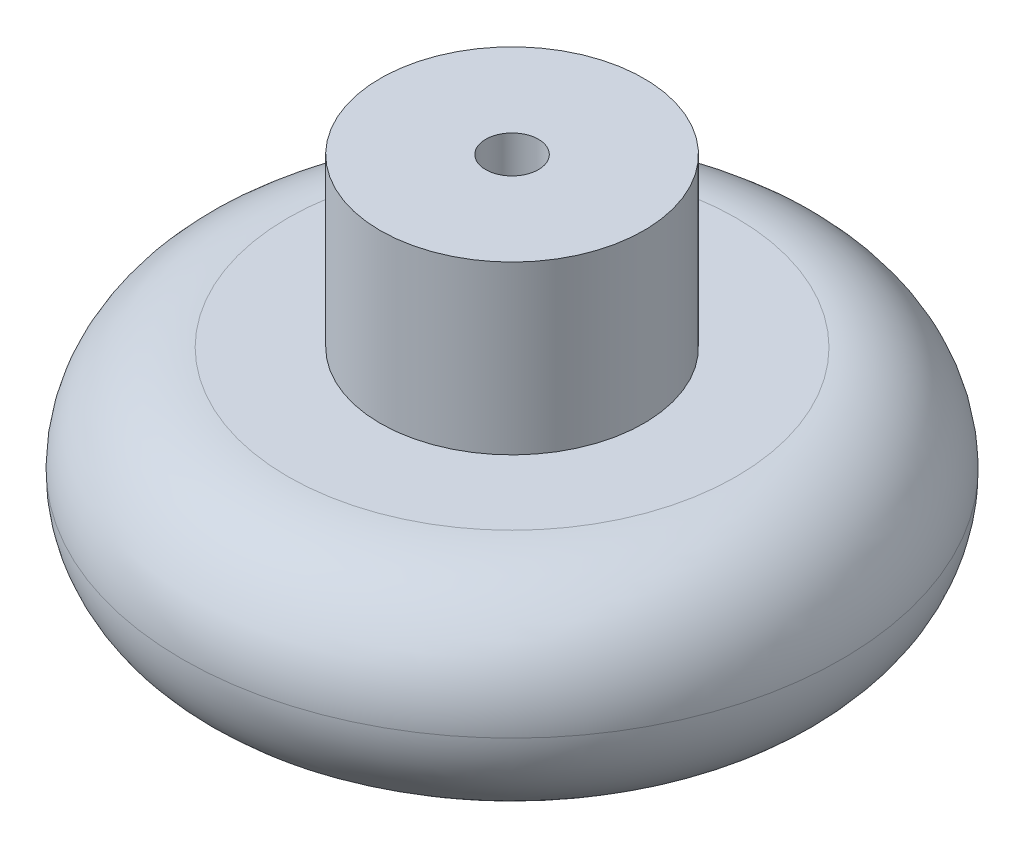
from build123d import *

# Parameters (mm, degrees)
SKETCH_1_R                = 37.5
EXTRUDE_1_DEPTH           = 24
SKETCH_3_R                = 15
EXTRUDE_2_DEPTH           = 19
HOLE_WIZARD_6_0_6_1_D     = 6
HOLE_WIZARD_6_0_6_1_DEPTH = 15
HOLE_WIZARD_6_0_6_1_TIP   = 1.802581857
FILLET_1_R                = 12
HOLE_WIZARD_M6_2_D        = 5
HOLE_WIZARD_M6_2_DEPTH    = 15
HOLE_WIZARD_M6_2_TIP      = 1.502151548


with BuildPart() as part:
    # 草图1 → 凸台-拉伸1 (new body)
    with BuildSketch(Plane(origin=(0, 0, 0), x_dir=(1, 0, 0), z_dir=(0, 1, 0))):
        with Locations(Location((0, 0, 0), (0, 0, 270))):
            Circle(SKETCH_1_R)
    extrude(amount=EXTRUDE_1_DEPTH)

    # 草图3 → 凸台-拉伸2 (add)
    with BuildSketch(Plane(origin=(0, 24, 0), x_dir=(1, 0, 0), z_dir=(0, 1, 0))):
        with Locations(Location((0, 0, 0), (0, 0, 270))):
            Circle(SKETCH_3_R)
    extrude(amount=EXTRUDE_2_DEPTH)

    # Ø6.0 (6) 直径孔1
    with Locations(Plane(origin=(0, 43, 0), x_dir=(1, 0, 0), z_dir=(0, 1, 0))):
        with Locations((0, 0)):
            Hole(HOLE_WIZARD_6_0_6_1_D / 2, depth=HOLE_WIZARD_6_0_6_1_DEPTH)
            with Locations((0, 0, -(HOLE_WIZARD_6_0_6_1_DEPTH + HOLE_WIZARD_6_0_6_1_TIP / 2))):  # 118° drill point
                Cone(0, HOLE_WIZARD_6_0_6_1_D / 2, HOLE_WIZARD_6_0_6_1_TIP, mode=Mode.SUBTRACT)

    # 圆角1
    fillet_1_edges = [part.edges().sort_by_distance(p)[0] for p in [
        (0, 0, -37.5),
        (0, 24, -37.5),
    ]]
    fillet(fillet_1_edges, radius=FILLET_1_R - 0.0001)  # a hair under: the kernel refuses the full size

    # M6 螺纹孔的螺纹孔钻头2
    with Locations(Plane(origin=(-4.612956818, 32.989820413, -14.273073579), x_dir=(-0.951538238599, 0, 0.307530454563), z_dir=(-0.307530454563, 0, -0.951538238599))):
        with Locations((0, 0)):
            Hole(HOLE_WIZARD_M6_2_D / 2, depth=HOLE_WIZARD_M6_2_DEPTH)
            with Locations((0, 0, -(HOLE_WIZARD_M6_2_DEPTH + HOLE_WIZARD_M6_2_TIP / 2))):  # 118° drill point
                Cone(0, HOLE_WIZARD_M6_2_D / 2, HOLE_WIZARD_M6_2_TIP, mode=Mode.SUBTRACT)


solid = part.part
